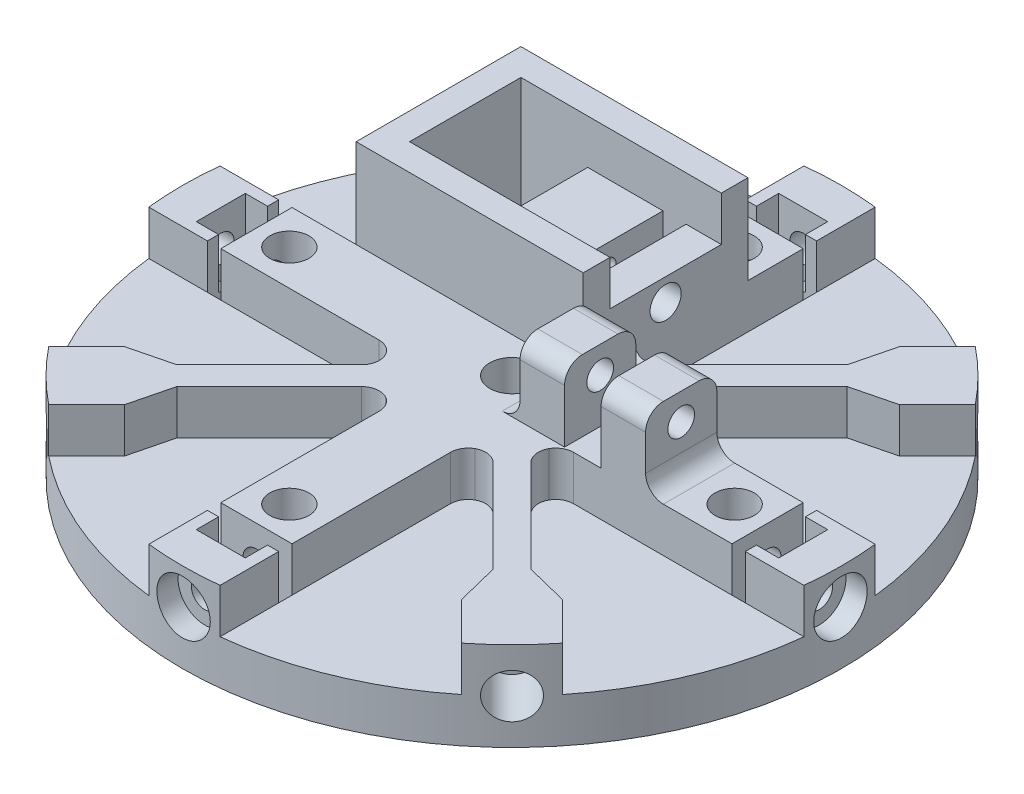
from build123d import *

# Parameters (mm, degrees)
SKETCH1_R                               = 37
SKETCH1_R_2                             = 2.5
BOSS_EXTRUDE1_DEPTH                     = 10
F_4_0MM_DOWEL_HOLE2_D                   = 4.4
CBORE_FOR_M6_HEX_HEAD_BOLT4_D           = 3
CBORE_FOR_M6_HEX_HEAD_BOLT4_DEPTH       = 11
CBORE_FOR_M6_HEX_HEAD_BOLT4_CBORE_D     = 6
CBORE_FOR_M6_HEX_HEAD_BOLT4_CBORE_DEPTH = 2.5
CIRPATTERN1_COUNT                       = 4
SKETCH18_R                              = 2.5
CUT_EXTRUDE2_DEPTH                      = 6.5
CUT_EXTRUDE3_START                      = -5
CUT_EXTRUDE3_DEPTH                      = 5
CIRPATTERN4_COUNT                       = 4
SKETCH12_W                              = 15.95
SKETCH12_H                              = 12.5
SKETCH12_W_2                            = 3.95
BOSS_EXTRUDE2_DEPTH                     = 5
BOSS_EXTRUDE2_DIRECTION_2_REACH         = 55.273
CBORE_FOR_M5_HEX_HEAD_BOLT1_D           = 2
CBORE_FOR_M5_HEX_HEAD_BOLT1_DEPTH       = 12
CBORE_FOR_M5_HEX_HEAD_BOLT1_CBORE_D     = 3.5
CBORE_FOR_M5_HEX_HEAD_BOLT1_CBORE_DEPTH = 5
BOSS_EXTRUDE3_DEPTH                     = 10
BOSS_EXTRUDE3_DIRECTION_2_REACH         = 55.273
SKETCH17_W                              = 7.5
SKETCH17_H                              = 12.5
CUT_EXTRUDE1_DEPTH                      = 15
CIRPATTERN2_COUNT                       = 4
BOSS_EXTRUDE5_DEPTH                     = 5
CHAMFER1_SIZE                           = 5
CHAMFER1_SIZE_2                         = 3
CHAMFER2_SIZE                           = 5
CHAMFER2_SIZE_2                         = 3
CUT_EXTRUDE8_DEPTH                      = 1.5
CIRPATTERN7_COUNT                       = 4
CUT_EXTRUDE9_DEPTH                      = 2.5
CIRPATTERN8_COUNT                       = 4
SKETCH37_W                              = 5
SKETCH37_H                              = 8
BOSS_EXTRUDE8_DEPTH                     = 8
FILLET15_R                              = 2
F_1_0MM_DOWEL_HOLE1_D                   = 3
FILLET12_R                              = 2


with BuildPart() as part:
    # Sketch1 → Boss-Extrude1 (new body)
    with BuildSketch(Plane(origin=(0, 0, 0), x_dir=(1, 0, 0), z_dir=(0, 1, 0))):
        with Locations(Location((0, 0, 0), (0, 0, 270))):
            Circle(SKETCH1_R)
        with Locations(Location((0, 0, 0), (0, 0, 270))):
            Circle(SKETCH1_R_2, mode=Mode.SUBTRACT)
    extrude(amount=BOSS_EXTRUDE1_DEPTH)

    # Ø4.0mm Dowel Hole2 (through all)
    with Locations(Plane(origin=(0, 10, 0), x_dir=(1, 0, 0), z_dir=(0, 1, 0))):
        with Locations((0, 25), (25, 0), (0, -25), (-25, 0)):
            Hole(F_4_0MM_DOWEL_HOLE2_D / 2)

    # CBORE for M6 Hex Head Bolt4
    with Locations(Plane(origin=(37, 0, 0), x_dir=(0, 0, -1), z_dir=(1, 0, 0))):
        with Locations((0, 6)):
            cbore_for_m6_hex_head_bolt4 = CounterBoreHole(CBORE_FOR_M6_HEX_HEAD_BOLT4_D / 2, CBORE_FOR_M6_HEX_HEAD_BOLT4_CBORE_D / 2, CBORE_FOR_M6_HEX_HEAD_BOLT4_CBORE_DEPTH, depth=CBORE_FOR_M6_HEX_HEAD_BOLT4_DEPTH)

    # CirPattern1: CBORE for M6 Hex Head Bolt4 ×4 about axis
    cirpattern1_axis = Axis((0, 0, 0), (0, 1, 0))
    for i in range(1, CIRPATTERN1_COUNT):
        add(cbore_for_m6_hex_head_bolt4.rotate(cirpattern1_axis, i * 360 / CIRPATTERN1_COUNT), mode=Mode.SUBTRACT)

    # Sketch18 → Cut-Extrude2 (cut)
    with BuildSketch(Plane(origin=(26.162950904, 0, 26.162950904), x_dir=(0, -1, 0), z_dir=(0.7071067811865464, 0, 0.7071067811865488))):
        with Locations(Location((-5, 0, 0), (0, 0, 90))):
            Circle(SKETCH18_R)
    cut_extrude2 = extrude(amount=-CUT_EXTRUDE2_DEPTH, mode=Mode.SUBTRACT)

    # Sketch19 → Cut-Extrude3 (cut)
    with BuildSketch(Plane(origin=(0, 10, 0), x_dir=(1, 0, 0), z_dir=(0, 1, 0)).offset(CUT_EXTRUDE3_START)):
        with BuildLine():
            Line((-36.783148315, -4), (-9.656854249, -4))
            ThreePointArc((-9.656854249, -4), (-7.39103626, -7.39103626), (-4, -9.656854249))
            Line((-4, -9.656854249), (-4, -36.783148315))
            ThreePointArc((-4, -36.783148315), (-14.159286998, -34.183542703), (-23.181186483, -28.838040732))
            Line((-23.181186483, -28.838040732), (-15.403011889, -21.059866139))
            Line((-15.403011889, -21.059866139), (-21.059866139, -15.403011889))
            Line((-21.059866139, -15.403011889), (-28.838040732, -23.181186483))
            ThreePointArc((-28.838040732, -23.181186483), (-34.183542703, -14.159286998), (-36.783148315, -4))
        make_face()
    cut_extrude3 = extrude(amount=CUT_EXTRUDE3_DEPTH, mode=Mode.SUBTRACT)

    # CirPattern4: Cut-Extrude3 ×4 about axis
    cirpattern4_axis = Axis((0, 0, 0), (0, 1, 0))
    for i in range(1, CIRPATTERN4_COUNT):
        add(cut_extrude3.rotate(cirpattern4_axis, i * 360 / CIRPATTERN4_COUNT), mode=Mode.SUBTRACT)

    # Sketch12 → Boss-Extrude2 (add)
    with BuildSketch(Plane(origin=(0, 10, 0), x_dir=(1, 0, 0), z_dir=(0, 1, 0))):
        with Locations((-10.525, 13.25)):
            Rectangle(SKETCH12_W, SKETCH12_H)
        with Locations((2.025, 13.25)):
            Rectangle(SKETCH12_W_2, SKETCH12_H)
    extrude(amount=BOSS_EXTRUDE2_DEPTH)

    # Boss-Extrude2 direction 2: up to this face of the body (flat: up to its plane)
    boss_extrude2_direction_2_end = Plane(part.part.faces().sort_by_distance((-17.181742156, 5, -17.181742156))[0])
    # Sketch12 → Boss-Extrude2 direction 2 (add, up to the picked face)
    with BuildSketch(Plane(origin=(0, 10, 0), x_dir=(1, 0, 0), z_dir=(0, 1, 0)), mode=Mode.PRIVATE) as boss_extrude2_direction_2_sk1:
        with Locations((-10.525, 13.25)):
            Rectangle(SKETCH12_W, SKETCH12_H)
    boss_extrude2_direction_2_tool1 = split(extrude(boss_extrude2_direction_2_sk1.sketch, amount=-BOSS_EXTRUDE2_DIRECTION_2_REACH, mode=Mode.PRIVATE), bisect_by=boss_extrude2_direction_2_end, keep=Keep.BOTH, mode=Mode.PRIVATE)
    # Sketch12 → Boss-Extrude2 direction 2 (add, up to the picked face)
    with BuildSketch(Plane(origin=(0, 10, 0), x_dir=(1, 0, 0), z_dir=(0, 1, 0)), mode=Mode.PRIVATE) as boss_extrude2_direction_2_sk2:
        with Locations((2.025, 13.25)):
            Rectangle(SKETCH12_W_2, SKETCH12_H)
    boss_extrude2_direction_2_tool2 = split(extrude(boss_extrude2_direction_2_sk2.sketch, amount=-BOSS_EXTRUDE2_DIRECTION_2_REACH, mode=Mode.PRIVATE), bisect_by=boss_extrude2_direction_2_end, keep=Keep.BOTH, mode=Mode.PRIVATE)
    add(boss_extrude2_direction_2_tool1.solids().sort_by(Axis((-10.525, 10, -13.25), (0, -1, 0)))[0])
    add(boss_extrude2_direction_2_tool2.solids().sort_by(Axis((2.025, 10, -13.25), (0, -1, 0)))[0])

    # CBORE for M5 Hex Head Bolt1
    with Locations(Plane(origin=(4, 0, 0), x_dir=(0, 0, -1), z_dir=(1, 0, 0))):
        with Locations((13.25, 12.5)):
            CounterBoreHole(CBORE_FOR_M5_HEX_HEAD_BOLT1_D / 2, CBORE_FOR_M5_HEX_HEAD_BOLT1_CBORE_D / 2, CBORE_FOR_M5_HEX_HEAD_BOLT1_CBORE_DEPTH, depth=CBORE_FOR_M5_HEX_HEAD_BOLT1_DEPTH)

    # Sketch16 → Boss-Extrude3 (add)
    with BuildSketch(Plane(origin=(0, 10, 0), x_dir=(1, 0, 0), z_dir=(0, 1, 0))):
        Polygon((4, 4), (-21.5, 4), (-21.5, 22.5), (4, 22.5), (4, 19.5), (-18.5, 19.5), (-18.5, 7), (4, 7), align=None)
    extrude(amount=BOSS_EXTRUDE3_DEPTH)

    # Boss-Extrude3 direction 2: up to this face of the body (flat: up to its plane)
    boss_extrude3_direction_2_end = Plane(part.part.faces().sort_by_distance((-25.720906493, 5, -10.74619567))[0])
    # Sketch16 → Boss-Extrude3 direction 2 (add, up to the picked face)
    with BuildSketch(Plane(origin=(0, 10, 0), x_dir=(1, 0, 0), z_dir=(0, 1, 0)), mode=Mode.PRIVATE) as boss_extrude3_direction_2_sk1:
        Polygon((4, 4), (-21.5, 4), (-21.5, 22.5), (4, 22.5), (4, 19.5), (-18.5, 19.5), (-18.5, 7), (4, 7), align=None)
    boss_extrude3_direction_2_tool1 = split(extrude(boss_extrude3_direction_2_sk1.sketch, amount=-BOSS_EXTRUDE3_DIRECTION_2_REACH, mode=Mode.PRIVATE), bisect_by=boss_extrude3_direction_2_end, keep=Keep.BOTH, mode=Mode.PRIVATE)
    add(boss_extrude3_direction_2_tool1.solids().sort_by(Axis((-8.75, 10, -4.31504), (0, -1, 0)))[0])

    # Sketch17 → Cut-Extrude1 (cut)
    with BuildSketch(Plane(origin=(0, 15, 0), x_dir=(1, 0, 0), z_dir=(0, 1, 0))):
        with Locations((-14.75, 13.25)):
            Rectangle(SKETCH17_W, SKETCH17_H)
    extrude(amount=-CUT_EXTRUDE1_DEPTH, mode=Mode.SUBTRACT)

    # CirPattern2: Cut-Extrude2 ×4 about axis
    cirpattern2_axis = Axis((0, 0, 0), (0, 1, 0))
    for i in range(1, CIRPATTERN2_COUNT):
        add(cut_extrude2.rotate(cirpattern2_axis, i * 360 / CIRPATTERN2_COUNT), mode=Mode.SUBTRACT)

    # Sketch21 → Boss-Extrude5 (add)
    with BuildSketch(Plane(origin=(0, 5, 0), x_dir=(1, 0, 0), z_dir=(0, 1, 0))):
        with BuildLine():
            Line((-19.292099186, -17.170778842), (-8.375194812, -6.253874468))
            ThreePointArc((-8.375194812, -6.253874468), (-7.39103626, -7.39103626), (-6.253874468, -8.375194812))
            Line((-6.253874468, -8.375194812), (-17.170778842, -19.292099186))
            Line((-17.170778842, -19.292099186), (-19.292099186, -17.170778842))
        make_face()
        with BuildLine():
            Line((19.292099186, -17.170778842), (8.375194812, -6.253874468))
            ThreePointArc((8.375194812, -6.253874468), (7.39103626, -7.39103626), (6.253874468, -8.375194812))
            Line((6.253874468, -8.375194812), (17.170778842, -19.292099186))
            Line((17.170778842, -19.292099186), (19.292099186, -17.170778842))
        make_face()
        with BuildLine():
            Line((6.253874468, 8.375194812), (17.170778842, 19.292099186))
            Line((17.170778842, 19.292099186), (19.292099186, 17.170778842))
            Line((19.292099186, 17.170778842), (8.375194812, 6.253874468))
            ThreePointArc((8.375194812, 6.253874468), (7.39103626, 7.39103626), (6.253874468, 8.375194812))
        make_face()
    extrude(amount=BOSS_EXTRUDE5_DEPTH)

    # Chamfer1
    # the kernel refuses this chamfer: 5, 3 mm, written as the material it takes off along each edge
    with BuildSketch(Plane(origin=(15.403011889, 5, -21.059866139), x_dir=(0.6929000778052421, 0, -0.7210336206984315), z_dir=(0, 1, 0))) as chamfer1_piece_1_section:
        Polygon((CHAMFER1_SIZE * 0.99980210636, -CHAMFER1_SIZE * 0.0198934189586), (-CHAMFER1_SIZE_2 * 0.0198934189586, -CHAMFER1_SIZE_2 * 0.99980210636), (0, 0), align=None)
    chamfer1_piece_1 = extrude(amount=17.931305486, mode=Mode.PRIVATE)
    chamfer1_piece_1 = split(chamfer1_piece_1, bisect_by=Plane(origin=(18.377349937, 7.5, -20.498670281), z_dir=(-0.7071067811865474, 0, -0.7071067811865478)), keep=Keep.TOP, mode=Mode.PRIVATE)
    add(chamfer1_piece_1, mode=Mode.SUBTRACT)
    with BuildSketch(Plane(origin=(21.059866139, 5, 15.403011889), x_dir=(0.7210336206984311, 0, 0.6929000778052424), z_dir=(0, 1, 0))) as chamfer1_piece_2_section:
        Polygon((CHAMFER1_SIZE * 0.99980210636, -CHAMFER1_SIZE * 0.0198934189586), (-CHAMFER1_SIZE_2 * 0.0198934189586, -CHAMFER1_SIZE_2 * 0.99980210636), (0, 0), align=None)
    chamfer1_piece_2 = extrude(amount=17.931305486, mode=Mode.PRIVATE)
    chamfer1_piece_2 = split(chamfer1_piece_2, bisect_by=Plane(origin=(20.498670281, 7.5, 18.377349937), z_dir=(0.7071067811865472, 0, -0.7071067811865479)), keep=Keep.TOP, mode=Mode.PRIVATE)
    add(chamfer1_piece_2, mode=Mode.SUBTRACT)
    with BuildSketch(Plane(origin=(-15.403011889, 5, 21.059866139), x_dir=(-0.6929000778052419, 0, 0.7210336206984316), z_dir=(0, 1, 0))) as chamfer1_piece_3_section:
        Polygon((CHAMFER1_SIZE * 0.99980210636, -CHAMFER1_SIZE * 0.0198934189586), (-CHAMFER1_SIZE_2 * 0.0198934189586, -CHAMFER1_SIZE_2 * 0.99980210636), (0, 0), align=None)
    chamfer1_piece_3 = extrude(amount=17.931305486, mode=Mode.PRIVATE)
    chamfer1_piece_3 = split(chamfer1_piece_3, bisect_by=Plane(origin=(-18.377349937, 7.5, 20.498670281), z_dir=(0.7071067811865476, 0, 0.7071067811865475)), keep=Keep.TOP, mode=Mode.PRIVATE)
    add(chamfer1_piece_3, mode=Mode.SUBTRACT)

    # Chamfer2
    # the kernel refuses this chamfer: 5, 3 mm, written as the material it takes off along each edge
    with BuildSketch(Plane(origin=(21.059866139, 5, -15.403011889), x_dir=(0.7210336206984392, 0, -0.692900077805234), z_dir=(0, 1, 0))) as chamfer2_piece_1_section:
        Polygon((CHAMFER2_SIZE * 0.99980210636, CHAMFER2_SIZE * 0.0198934189586), (-CHAMFER2_SIZE_2 * 0.0198934189586, CHAMFER2_SIZE_2 * 0.99980210636), (0, 0), align=None)
    chamfer2_piece_1 = extrude(amount=17.931305486, mode=Mode.PRIVATE)
    chamfer2_piece_1 = split(chamfer2_piece_1, bisect_by=Plane(origin=(20.498670281, 7.5, -18.377349937), z_dir=(0.7071067811865472, 0, 0.7071067811865479)), keep=Keep.TOP, mode=Mode.PRIVATE)
    add(chamfer2_piece_1, mode=Mode.SUBTRACT)
    with BuildSketch(Plane(origin=(15.403011889, 5, 21.059866139), x_dir=(0.692900077805234, 0, 0.7210336206984392), z_dir=(0, 1, 0))) as chamfer2_piece_2_section:
        Polygon((CHAMFER2_SIZE * 0.99980210636, CHAMFER2_SIZE * 0.0198934189586), (-CHAMFER2_SIZE_2 * 0.0198934189586, CHAMFER2_SIZE_2 * 0.99980210636), (0, 0), align=None)
    chamfer2_piece_2 = extrude(amount=17.931305486, mode=Mode.PRIVATE)
    chamfer2_piece_2 = split(chamfer2_piece_2, bisect_by=Plane(origin=(18.377349937, 7.5, 20.498670281), z_dir=(-0.7071067811865474, 0, 0.7071067811865478)), keep=Keep.TOP, mode=Mode.PRIVATE)
    add(chamfer2_piece_2, mode=Mode.SUBTRACT)
    with BuildSketch(Plane(origin=(-21.059866139, 5, 15.403011889), x_dir=(-0.7210336206984391, 0, 0.6929000778052342), z_dir=(0, 1, 0))) as chamfer2_piece_3_section:
        Polygon((CHAMFER2_SIZE * 0.99980210636, CHAMFER2_SIZE * 0.0198934189586), (-CHAMFER2_SIZE_2 * 0.0198934189586, CHAMFER2_SIZE_2 * 0.99980210636), (0, 0), align=None)
    chamfer2_piece_3 = extrude(amount=17.931305486, mode=Mode.PRIVATE)
    chamfer2_piece_3 = split(chamfer2_piece_3, bisect_by=Plane(origin=(-20.498670281, 7.5, 18.377349937), z_dir=(-0.7071067811865476, 0, -0.7071067811865476)), keep=Keep.TOP, mode=Mode.PRIVATE)
    add(chamfer2_piece_3, mode=Mode.SUBTRACT)

    # Sketch34 → Cut-Extrude8 (cut)
    with BuildSketch(Plane.XY.offset(28.7)):
        with BuildLine():
            Line((4, 5), (4, 10))
            Line((4, 10), (-4, 10))
            Line((-4, 10), (-4, 5))
            ThreePointArc((-4, 5), (0, 1.876894374), (4, 5))
        make_face()
    cut_extrude8 = extrude(amount=CUT_EXTRUDE8_DEPTH, mode=Mode.SUBTRACT)

    # CirPattern7: Cut-Extrude8 ×4 about axis
    cirpattern7_axis = Axis((0, 0, 0), (0, 1, 0))
    for i in range(1, CIRPATTERN7_COUNT):
        add(cut_extrude8.rotate(cirpattern7_axis, i * 360 / CIRPATTERN7_COUNT), mode=Mode.SUBTRACT)

    # Sketch36 → Cut-Extrude9 (cut)
    with BuildSketch(Plane(origin=(0, 0, 30.2), x_dir=(-1, 0, 0), z_dir=(0, 0, -1))):
        Polygon((-2.75, 10), (-2.75, 4.41228676), (0, 2.824573519), (2.75, 4.41228676), (2.75, 10), align=None)
    cut_extrude9 = extrude(amount=-CUT_EXTRUDE9_DEPTH, mode=Mode.SUBTRACT)

    # CirPattern8: Cut-Extrude9 ×4 about axis
    cirpattern8_axis = Axis((0, 0, 0), (0, 1, 0))
    for i in range(1, CIRPATTERN8_COUNT):
        add(cut_extrude9.rotate(cirpattern8_axis, i * 360 / CIRPATTERN8_COUNT), mode=Mode.SUBTRACT)

    # Sketch37 → Boss-Extrude8 (add)
    with BuildSketch(Plane(origin=(0, 10, 0), x_dir=(1, 0, 0), z_dir=(0, 1, 0))):
        with Locations((16.5, 0)):
            Rectangle(SKETCH37_W, SKETCH37_H)
    boss_extrude8 = extrude(amount=BOSS_EXTRUDE8_DEPTH)

    # Fillet15
    # the kernel refuses this fillet: 2 mm, written as the material it adds along each edge
    with BuildSketch(Plane(origin=(4, 1.862925491, 9.656854249), x_dir=(0, 0, 1), z_dir=(0, 1, 0))) as fillet15_piece_1:
        with BuildLine():
            CenterArc((1.254829803, 2), FILLET15_R, 208.805043762, 61.194956238)
            ThreePointArc((-0.497698732, 1.036338373), (-0.234590445, 0.525016995), (0, 0))
            Line((0, 0), (1.254829803, 0))
        make_face()
    extrude(amount=8.137074509)
    with BuildSketch(Plane(origin=(9.656854249, 1.862925491, 4), x_dir=(1, 0, 0), z_dir=(0, 1, 0)), Plane(origin=(-4, 1.862925491, 9.656854249), x_dir=(0, 0, 1), z_dir=(0, 1, 0))) as fillet15_piece_2:
        with BuildLine():
            CenterArc((1.254829803, -2), FILLET15_R, 90, 61.194956238)
            ThreePointArc((-0.497698732, -1.036338373), (-0.234590445, -0.525016995), (0, 0))
            Line((0, 0), (1.254829803, 0))
        make_face()
    extrude(amount=8.137074509)
    with BuildSketch(Plane(origin=(9.656854249, 1.862925491, -4), x_dir=(-0.43291225876402817, 0, -0.9014360632966862), z_dir=(0, 1, 0)), Plane(origin=(-9.656854249, 1.862925491, 4), x_dir=(0.4329122587640282, 0, 0.901436063296686), z_dir=(0, 1, 0))) as fillet15_piece_3:
        with BuildLine():
            CenterArc((1.259640922, -1.996973356), FILLET15_R, 93.152521881, 61.194956238)
            Line((-0.543231205, -1.131148838), (0, 0))
            ThreePointArc((0, 0), (0.574826333, -0.015818005), (1.149652665, 0))
        make_face()
    extrude(amount=8.137074509)
    with BuildSketch(Plane(origin=(-6.253874468, 0.98449353, 8.375194812), x_dir=(0.841391703067711, 0, 0.5404257599419339), z_dir=(0, 1, 0)), Plane(origin=(8.375194812, 0.98449353, 6.253874468), x_dir=(0.5404257599419344, 0, -0.8413917030677107), z_dir=(0, 1, 0)), Plane(origin=(6.253874468, 0.98449353, -8.375194812), x_dir=(-0.8413917030677103, 0, -0.540425759941935), z_dir=(0, 1, 0))) as fillet15_piece_4:
        with BuildLine():
            CenterArc((1.612360898, -1.995038618), FILLET15_R, 94.036581983, 73.676044891)
            Line((-0.341824099, -1.5694085), (0, 0))
            ThreePointArc((0, 0), (0.735787069, -0.025929431), (1.471574137, 0))
        make_face()
    extrude(amount=9.01550647)
    with BuildSketch(Plane(origin=(-8.375194812, 0.98449353, 6.253874468), x_dir=(-0.7071067811865476, 0, 0.7071067811865476), z_dir=(0, 1, 0)), Plane(origin=(8.375194812, 0.98449353, -6.253874468), x_dir=(0.7071067811865475, 0, -0.7071067811865475), z_dir=(0, 1, 0))) as fillet15_piece_5:
        with BuildLine():
            CenterArc((1.606202588, -2), FILLET15_R, 90, 73.676044891)
            ThreePointArc((-0.313173137, -1.437864051), (-0.131251116, -0.724450199), (0, 0))
            Line((0, 0), (1.606202588, 0))
        make_face()
    extrude(amount=9.01550647)
    with BuildSketch(Plane(origin=(6.253874468, 0.98449353, 8.375194812), x_dir=(-0.841391703067689, 0, 0.5404257599419683), z_dir=(0, 1, 0))) as fillet15_piece_6:
        with BuildLine():
            CenterArc((1.612360898, 1.995038618), FILLET15_R, 192.287373126, 73.676044891)
            Line((-0.341824099, 1.5694085), (0, 0))
            ThreePointArc((0, 0), (0.735787069, 0.025929431), (1.471574137, 0))
        make_face()
    extrude(amount=9.01550647)

    # Mirror3: Boss-Extrude8 across plane
    add(boss_extrude8.mirror(Plane.ZY.offset(-11.95)))

    # Ø1.0mm Dowel Hole1 (through all)
    with Locations(Plane(origin=(19, 0, 0), x_dir=(0, 0, -1), z_dir=(1, 0, 0))):
        with Locations((0, 15)):
            Hole(F_1_0MM_DOWEL_HOLE1_D / 2)

    # Fillet12
    # the kernel refuses this fillet: 2 mm, written as the material it adds along each edge
    with BuildSketch(Plane(origin=(19, 10, 4), x_dir=(1, 0, 0), z_dir=(0, 0, -1))) as fillet12_piece_1:
        with BuildLine():
            CenterArc((FILLET12_R, -FILLET12_R), FILLET12_R, 90, 90)
            Line((0, -FILLET12_R), (0, 0))
            Line((0, 0), (FILLET12_R, 0))
        make_face()
    extrude(amount=8)
    with BuildSketch(Plane(origin=(4.9, 10, 4), x_dir=(-1, 0, 0), z_dir=(0, 0, -1))) as fillet12_piece_2:
        with BuildLine():
            CenterArc((FILLET12_R, FILLET12_R), FILLET12_R, 180, 90)
            Line((0, FILLET12_R), (0, 0))
            Line((0, 0), (FILLET12_R, 0))
        make_face()
    extrude(amount=8)
    # the kernel refuses this fillet: 2 mm, written as the material it takes off along each edge
    with BuildSketch(Plane(origin=(9, 18, 4), x_dir=(0, 0, -1), z_dir=(1, 0, 0)), Plane(origin=(24, 18, -4), x_dir=(0, 0, 1), z_dir=(-1, 0, 0)), Plane(origin=(-0.1, 18, -4), x_dir=(0, -1, 0), z_dir=(1, 0, 0))) as fillet12_2_piece_1:
        with BuildLine():
            CenterArc((FILLET12_R, -FILLET12_R), FILLET12_R, 90, 90)
            Line((0, -FILLET12_R), (0, 0))
            Line((0, 0), (FILLET12_R, 0))
        make_face()
    extrude(amount=15, mode=Mode.SUBTRACT)
    with BuildSketch(Plane(origin=(14.9, 18, 4), x_dir=(0, 0, -1), z_dir=(-1, 0, 0))) as fillet12_2_piece_2:
        with BuildLine():
            CenterArc((FILLET12_R, FILLET12_R), FILLET12_R, 180, 90)
            Line((0, FILLET12_R), (0, 0))
            Line((0, 0), (FILLET12_R, 0))
        make_face()
    extrude(amount=15, mode=Mode.SUBTRACT)


solid = part.part
